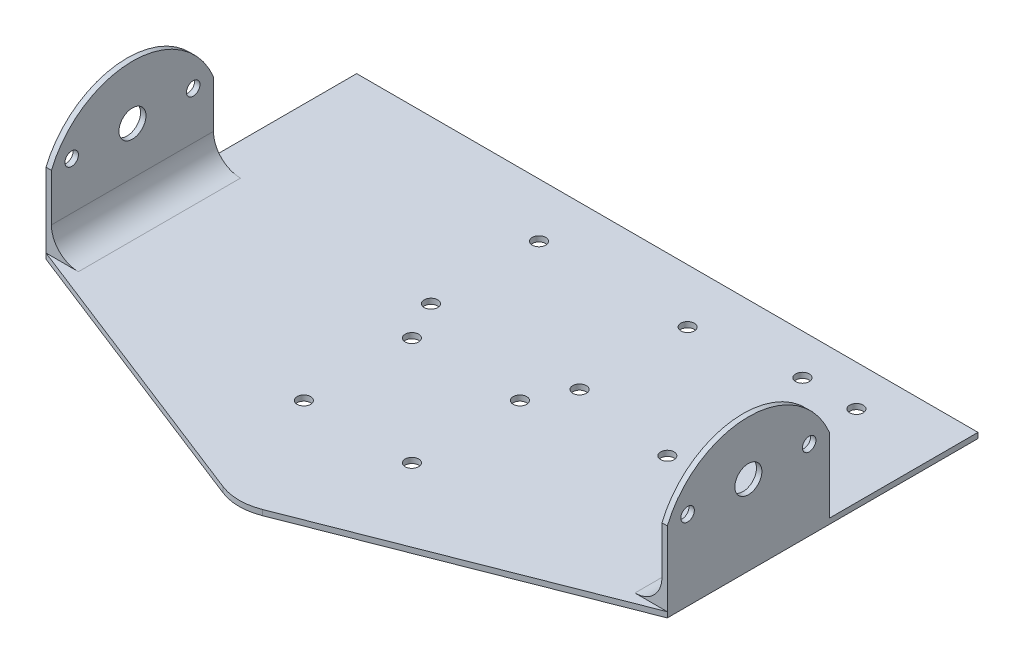
from build123d import *

# Parameters (mm, degrees)
BOSS_EXTRUDE1_DEPTH      = 2
SKETCH2_W                = 2
SKETCH2_H                = 60
BOSS_EXTRUDE2_DEPTH      = 55
SKETCH3_R                = 5
CUT_EXTRUDE1_DEPTH       = 283
SKETCH4_R                = 2.5
CUT_EXTRUDE2_DEPTH       = 283
SKETCH9_W                = 230
SKETCH9_H                = 50
BOSS_EXTRUDE3_DEPTH      = 2
SKETCH13_W               = 230
SKETCH13_H               = 10
BOSS_EXTRUDE6_DEPTH      = 20
CUT_EXTRUDE9_START       = -230
CUT_EXTRUDE9_DEPTH       = 230
SKETCH31_R               = 2.5
CUT_EXTRUDE11_DEPTH      = 10
SKETCH32_R               = 2.5
CUT_EXTRUDE12_DEPTH      = 10
SKETCH33_R               = 2.5
CUT_EXTRUDE13_DEPTH      = 10
CUT_EXTRUDE14_DEPTH      = 180.947909129
CUT_EXTRUDE14_DEPTH_BACK = 180.947909129
CUT_EXTRUDE16_DEPTH      = 151.685931659
CUT_EXTRUDE16_DEPTH_BACK = 151.685931659
BOSS_EXTRUDE8_DEPTH      = 60


# Read off the part's stored shape, not the designer's step: Cut-Extrude9
with BuildPart() as part:
    # Sketch1 → Boss-Extrude1 (new body)
    with BuildSketch(Plane(origin=(0, 0, 0), x_dir=(1, 0, 0), z_dir=(0, 1, 0))):
        Polygon((115, 50), (115, 80), (-115, 80), (-115, 50), (-115, -50), (-115, -75), (115, -75), (115, -50), align=None)
    extrude(amount=BOSS_EXTRUDE1_DEPTH)

    # Sketch2 → Boss-Extrude2 (add)
    with BuildSketch(Plane(origin=(0, 2, 0), x_dir=(1, 0, 0), z_dir=(0, 1, 0))):
        with Locations((-114, 0)):
            Rectangle(SKETCH2_W, SKETCH2_H)
        with Locations((114, 0)):
            Rectangle(SKETCH2_W, SKETCH2_H)
    extrude(amount=BOSS_EXTRUDE2_DEPTH)

    # Sketch3 → Cut-Extrude1 (cut)
    with BuildSketch(Plane.ZY.offset(115)):
        with Locations((0, 29.5)):
            Circle(SKETCH3_R)
    extrude(amount=-CUT_EXTRUDE1_DEPTH, mode=Mode.SUBTRACT)

    # Sketch4 → Cut-Extrude2 (cut)
    with BuildSketch(Plane.ZY.offset(115)):
        with Locations((-22.5, 29.5)):
            Circle(SKETCH4_R)
        with Locations((22.5, 29.5)):
            Circle(SKETCH4_R)
    extrude(amount=-CUT_EXTRUDE2_DEPTH, mode=Mode.SUBTRACT)

    # Sketch9 → Boss-Extrude3 (add)
    with BuildSketch(Plane(origin=(0, 2, 0), x_dir=(1, 0, 0), z_dir=(0, 1, 0))):
        with Locations((0, 105)):
            Rectangle(SKETCH9_W, SKETCH9_H)
    extrude(amount=-BOSS_EXTRUDE3_DEPTH)

    # Sketch13 → Boss-Extrude6 (add)
    with BuildSketch(Plane.XZ):
        with Locations((0, -125)):
            Rectangle(SKETCH13_W, SKETCH13_H)
    extrude(amount=BOSS_EXTRUDE6_DEPTH)

    # Cut-Extrude9 outline → Cut-Extrude9 (cut)
    with BuildSketch(Plane(origin=(115, 0, 0), x_dir=(0, 0, -1), z_dir=(1, 0, 0)).offset(CUT_EXTRUDE9_START)):
        with BuildLine():
            Line((-30, 57), (-30, 29.5))
            ThreePointArc((-30, 29.5), (0, 49.5), (30, 29.5))
            Line((30, 29.5), (30, 57))
            Line((30, 57), (-30, 57))
        make_face()
    extrude(amount=CUT_EXTRUDE9_DEPTH, mode=Mode.SUBTRACT)

    # Sketch31 → Cut-Extrude11 (cut)
    with BuildSketch(Plane(origin=(0, 2, 0), x_dir=(1, 0, 0), z_dir=(0, 1, 0))):
        with Locations(Location((-27.5, 65, 0), (0, 0, 270))):
            Circle(SKETCH31_R)
        with Locations(Location((27.5, 65, 0), (0, 0, 270))):
            Circle(SKETCH31_R)
        with Locations(Location((-27.5, 25, 0), (0, 0, 270))):
            Circle(SKETCH31_R)
        with Locations(Location((27.5, 25, 0), (0, 0, 270))):
            Circle(SKETCH31_R)
    extrude(amount=-CUT_EXTRUDE11_DEPTH, mode=Mode.SUBTRACT)

    # Sketch32 → Cut-Extrude12 (cut)
    with BuildSketch(Plane(origin=(0, 2, 0), x_dir=(1, 0, 0), z_dir=(0, 1, 0))):
        with Locations(Location((85, 70, 0), (0, 0, 270))):
            Circle(SKETCH32_R)
        with Locations(Location((65, 70, 0), (0, 0, 270))):
            Circle(SKETCH32_R)
        with Locations(Location((65, 20, 0), (0, 0, 90))):
            Circle(SKETCH32_R)
        with Locations(Location((85, 20, 0), (0, 0, 90))):
            Circle(SKETCH32_R)
    extrude(amount=-CUT_EXTRUDE12_DEPTH, mode=Mode.SUBTRACT)

    # Sketch33 → Cut-Extrude13 (cut)
    with BuildSketch(Plane(origin=(0, 2, 0), x_dir=(1, 0, 0), z_dir=(0, 1, 0))):
        with Locations(Location((-20, 10.45, 0), (0, 0, 270))):
            Circle(SKETCH33_R)
        with Locations(Location((20, 10.45, 0), (0, 0, 270))):
            Circle(SKETCH33_R)
        with Locations(Location((-20, -29.55, 0), (0, 0, 270))):
            Circle(SKETCH33_R)
        with Locations(Location((20, -29.55, 0), (0, 0, 90))):
            Circle(SKETCH33_R)
    extrude(amount=-CUT_EXTRUDE13_DEPTH, mode=Mode.SUBTRACT)

    # Sketch34 → Cut-Extrude14 (cut, two sides: drawn at the far end of the back side and taken through both)
    with BuildSketch(Plane(origin=(0, 2, 0), x_dir=(1, 0, 0), z_dir=(0, 1, 0)).offset(-CUT_EXTRUDE14_DEPTH_BACK)):
        Polygon((685.357029045, 85), (115, 85), (-115, 85), (-685.357029045, 85), (-685.357029045, 1225.71405809), (685.357029045, 1225.71405809), align=None)
    extrude(amount=CUT_EXTRUDE14_DEPTH + CUT_EXTRUDE14_DEPTH_BACK, mode=Mode.SUBTRACT)

    # Sketch36 → Cut-Extrude16 (cut, two sides: drawn at the far end of the back side and taken through both)
    with BuildSketch(Plane(origin=(0, 2, 0), x_dir=(1, 0, 0), z_dir=(0, 1, 0)).offset(-CUT_EXTRUDE16_DEPTH_BACK)):
        with BuildLine():
            Line((-603.246524362, 161.052987794), (-115, -30))
            Line((-115, -30), (-7.287986972, -72.148179011))
            ThreePointArc((-7.287986972, -72.148179011), (0, -73.523323417), (7.287986972, -72.148179011))
            Line((7.287986972, -72.148179011), (115, -30))
            Line((115, -30), (603.246524362, 161.052987794))
            Line((603.246524362, 161.052987794), (603.246524362, -887.538281856))
            Line((603.246524362, -887.538281856), (-603.246524362, -887.538281856))
            Line((-603.246524362, -887.538281856), (-603.246524362, 161.052987794))
        make_face()
    extrude(amount=CUT_EXTRUDE16_DEPTH + CUT_EXTRUDE16_DEPTH_BACK, mode=Mode.SUBTRACT)

    # Sketch37 → Boss-Extrude8 (add)
    with BuildSketch(Plane(origin=(0, 0, -30), x_dir=(-1, 0, 0), z_dir=(0, 0, -1))):
        with BuildLine():
            Line((-103, 2), (-113, 2))
            Line((-113, 2), (-113, 12))
            ThreePointArc((-113, 12), (-110.071067812, 4.928932188), (-103, 2))
        make_face()
        with BuildLine():
            Line((103, 2), (113, 2))
            Line((113, 2), (113, 12))
            ThreePointArc((113, 12), (110.071067812, 4.928932188), (103, 2))
        make_face()
    extrude(amount=-BOSS_EXTRUDE8_DEPTH)


solid = part.part
